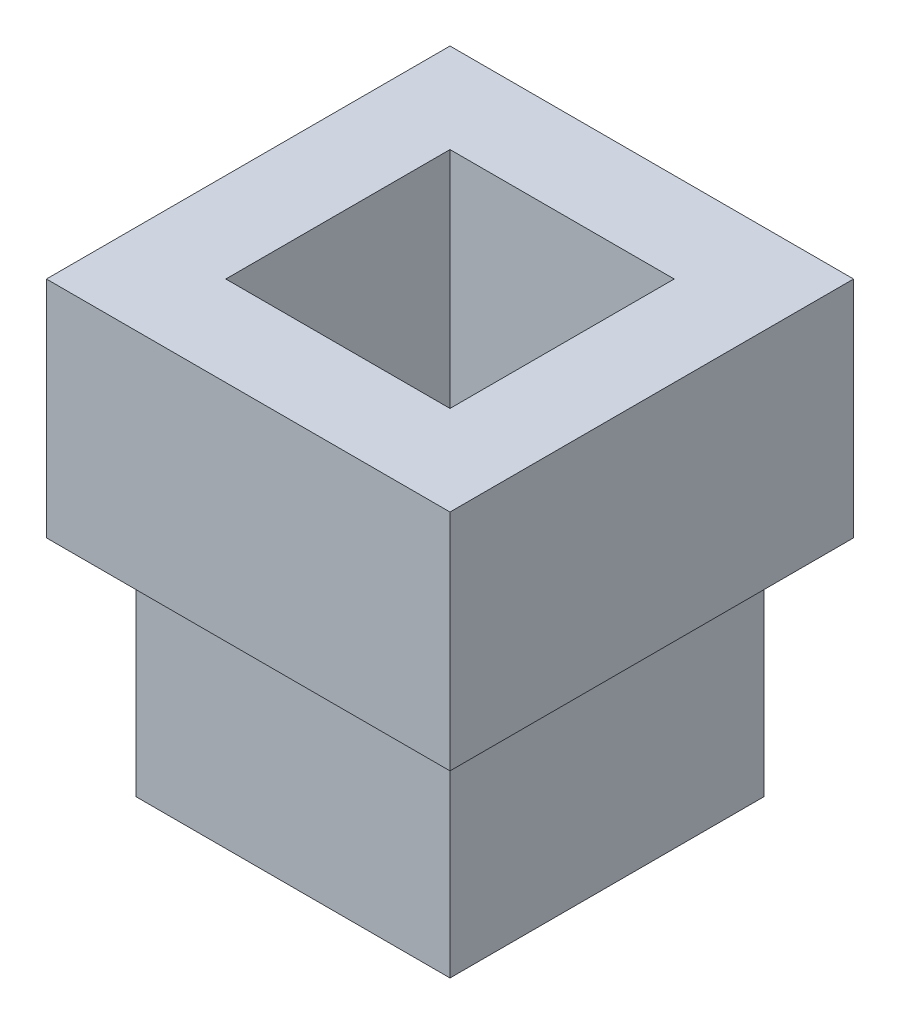
from build123d import *

# Parameters (mm, degrees)
SKETCH1_W           = 45
SKETCH1_H           = 45
SKETCH1_W_2         = 25
SKETCH1_H_2         = 25
BOSS_EXTRUDE1_DEPTH = 25
SKETCH1_3_W         = 35
SKETCH1_3_H         = 35
SKETCH1_3_W_2       = 25
SKETCH1_3_H_2       = 25
BOSS_EXTRUDE2_DEPTH = 25


with BuildPart() as part:
    # Sketch1 → Boss-Extrude1 (new body)
    with BuildSketch(Plane(origin=(0, 0, 0), x_dir=(1, 0, 0), z_dir=(0, 1, 0))):
        Rectangle(SKETCH1_W, SKETCH1_H)
        Rectangle(SKETCH1_W_2, SKETCH1_H_2, mode=Mode.SUBTRACT)
    extrude(amount=BOSS_EXTRUDE1_DEPTH)

    # Sketch1<3> → Boss-Extrude2 (add)
    with BuildSketch(Plane(origin=(0, 0, 0), x_dir=(1, 0, 0), z_dir=(0, 1, 0))):
        Rectangle(SKETCH1_3_W, SKETCH1_3_H)
        Rectangle(SKETCH1_3_W_2, SKETCH1_3_H_2, mode=Mode.SUBTRACT)
    extrude(amount=-BOSS_EXTRUDE2_DEPTH)


solid = part.part
